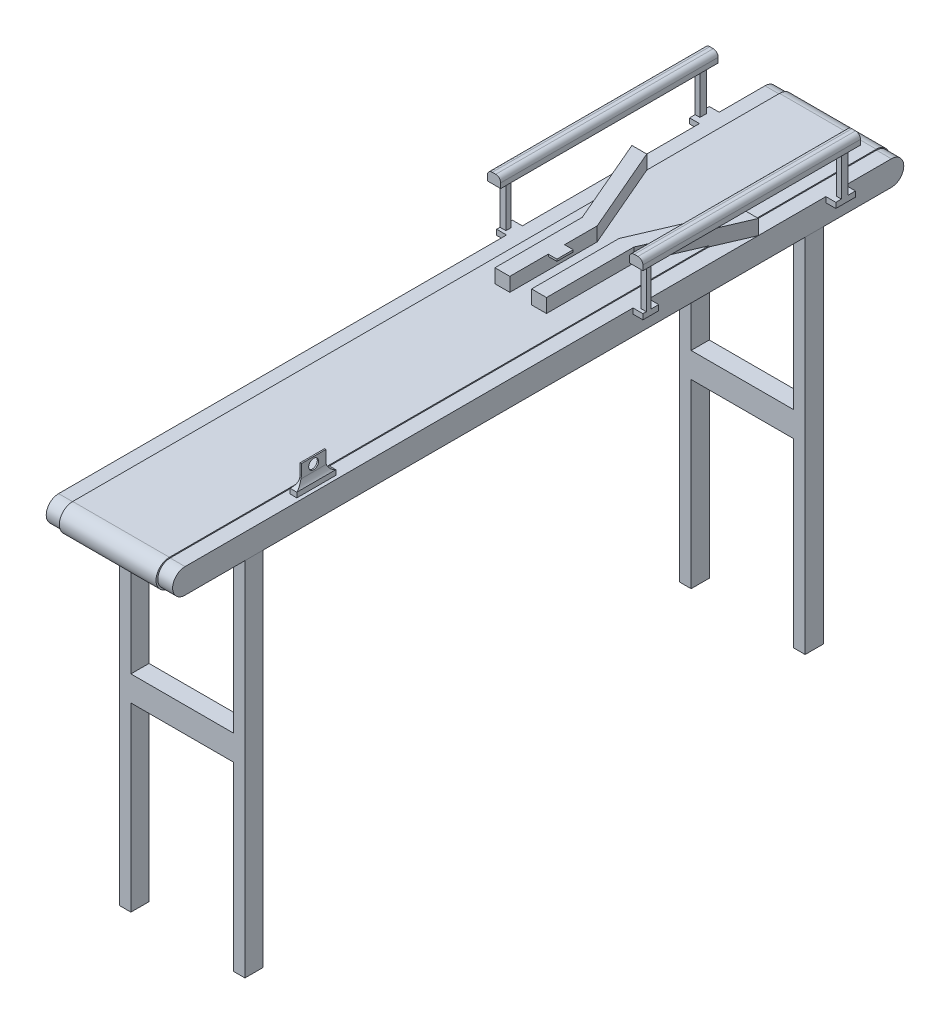
from build123d import *

# Parameters (mm, degrees)
CROQUIS1_W                   = 255
CROQUIS1_H                   = 1475
SALIENTE_EXTRUIR1_DEPTH      = 50
CORTAR_EXTRUIR1_DEPTH        = 1498.714926146
SALIENTE_EXTRUIR2_START      = -30
SALIENTE_EXTRUIR2_DEPTH      = 195
CROQUIS6_W                   = 23.089927544
CROQUIS6_H                   = 36.579574148
SALIENTE_EXTRUIR3_DEPTH      = 731
SALIENTE_EXTRUIR4_REACH      = 1668.675
CROQUIS7_W                   = 36.579574148
CROQUIS7_H                   = 50.716877677
SALIENTE_EXTRUIR5_DEPTH      = 20
SALIENTE_EXTRUIR5_DEPTH_BACK = 275
CROQUIS9_W                   = 39.769947059
CROQUIS9_H                   = 10.786278749
CROQUIS9_W_2                 = 31.799661674
CROQUIS10_W                  = 9.640500607
CROQUIS10_H                  = 13.128056889
CROQUIS10_W_2                = 10.31069774
CROQUIS10_W_3                = 11.904259836
CROQUIS10_H_2                = 10.427339656
CROQUIS10_H_3                = 9.058106281
SALIENTE_EXTRUIR6_DEPTH      = 85
CROQUIS11_W                  = 27.062582302
CROQUIS11_H                  = 438.810649055
CROQUIS11_W_2                = 27.39424904
SALIENTE_EXTRUIR7_DEPTH      = 20
REDONDEO1_R                  = 10
SALIENTE_EXTRUIR8_DEPTH      = 30
CROQUIS13_W                  = 30
CROQUIS13_H                  = 176.208611665
SALIENTE_EXTRUIR9_DEPTH      = 30
CROQUIS14_W                  = 17.440501772
CROQUIS14_H                  = 32.827990866
SALIENTE_EXTRUIR10_DEPTH     = 4
CROQUIS15_W                  = 88.168794784
CROQUIS15_H                  = 128.918218337
SALIENTE_EXTRUIR11_DEPTH     = 10
CROQUIS16_R                  = 2.5
CROQUIS16_W                  = 10.651190854
CROQUIS16_H                  = 24.522509177
SALIENTE_EXTRUIR12_DEPTH     = 5
CROQUIS17_W                  = 58.168794784
CROQUIS17_H                  = 13.953634649
SALIENTE_EXTRUIR13_DEPTH     = 2
CROQUIS18_W                  = 58.168794784
CROQUIS18_H                  = 2
SALIENTE_EXTRUIR14_DEPTH     = 40
CROQUIS19_W                  = 13.463338371
CROQUIS19_H                  = 78.536140501
SALIENTE_EXTRUIR15_DEPTH     = 10
CROQUIS20_W                  = 2.68
CROQUIS20_H                  = 49.502102937
SALIENTE_EXTRUIR16_DEPTH     = 40
REDONDEO2_R                  = 20
CROQUIS21_R                  = 10
CORTAR_EXTRUIR2_DEPTH        = 40


with BuildPart() as part:
    # Croquis1 → Saliente-Extruir1 (new body)
    with BuildSketch(Plane(origin=(0, 0, 0), x_dir=(1, 0, 0), z_dir=(0, 1, 0))):
        with Locations((-127.5, 737.5)):
            Rectangle(CROQUIS1_W, CROQUIS1_H)
    extrude(amount=SALIENTE_EXTRUIR1_DEPTH)

    # Croquis2 → Cortar-Extruir1 (cut, through all)
    with BuildSketch(Plane.ZY.offset(255)):
        with BuildLine():
            Line((6.458362323, -12.380571648), (-25, 0))
            ThreePointArc((-25, 0), (0, 25), (-25, 50))
            Line((-25, 50), (5.438958409, 62.035914062))
            Line((5.438958409, 62.035914062), (6.458362323, -12.380571648))
        make_face()
        with BuildLine():
            Line((-1481.23440759, 62.380571648), (-1449.776045267, 50))
            ThreePointArc((-1449.776045267, 50), (-1474.776045267, 25), (-1449.776045267, 0))
            Line((-1449.776045267, 0), (-1480.215003676, -12.035914062))
            Line((-1480.215003676, -12.035914062), (-1481.23440759, 62.380571648))
        make_face()
    extrude(amount=-CORTAR_EXTRUIR1_DEPTH, mode=Mode.SUBTRACT)

    # Croquis5 → Saliente-Extruir2 (add)
    with BuildSketch(Plane.ZY.offset(255).offset(SALIENTE_EXTRUIR2_START)):
        with BuildLine():
            Line((-1449.276045267, 52), (-23.5, 52))
            ThreePointArc((-23.5, 52), (3.5, 25), (-23.5, -2))
            Line((-23.5, -2), (-1449.276045267, -2))
            ThreePointArc((-1449.276045267, -2), (-1476.276045267, 25), (-1449.276045267, 52))
        make_face()
    extrude(amount=-SALIENTE_EXTRUIR2_DEPTH)

    # Croquis6 → Saliente-Extruir3 (add)
    with BuildSketch(Plane.XZ):
        with Locations((-243.455036228, -166.019692376)):
            Rectangle(CROQUIS6_W, CROQUIS6_H)
        with Locations((-13.455036228, -166.019692376)):
            Rectangle(CROQUIS6_W, CROQUIS6_H)
        with Locations((-13.455036228, -1296.019692376)):
            Rectangle(CROQUIS6_W, CROQUIS6_H)
        with Locations((-243.455036228, -1296.019692376)):
            Rectangle(CROQUIS6_W, CROQUIS6_H)
    extrude(amount=SALIENTE_EXTRUIR3_DEPTH)

    # Croquis7 → Saliente-Extruir4 (add, up to next)
    with BuildSketch(Plane(origin=(-1.910072456, 0, 0), x_dir=(0, 0, -1), z_dir=(1, 0, 0)), mode=Mode.PRIVATE) as saliente_extruir4_sk1:
        with Locations((166.019692376, -340.141561162)):
            Rectangle(CROQUIS7_W, CROQUIS7_H)
    saliente_extruir4_tool1 = extrude(saliente_extruir4_sk1.sketch, amount=-SALIENTE_EXTRUIR4_REACH, mode=Mode.PRIVATE) - part.part
    # Croquis7 → Saliente-Extruir4 (add, up to next)
    with BuildSketch(Plane(origin=(-1.910072456, 0, 0), x_dir=(0, 0, -1), z_dir=(1, 0, 0)), mode=Mode.PRIVATE) as saliente_extruir4_sk2:
        with Locations((1296.019692376, -340.141561162)):
            Rectangle(CROQUIS7_W, CROQUIS7_H)
    saliente_extruir4_tool2 = extrude(saliente_extruir4_sk2.sketch, amount=-SALIENTE_EXTRUIR4_REACH, mode=Mode.PRIVATE) - part.part
    add(saliente_extruir4_tool1.solids().sort_by_distance((-1.910072, -340.141561, -166.019692))[0])
    add(saliente_extruir4_tool2.solids().sort_by_distance((-1.910072, -340.141561, -1296.019692))[0])

    # Croquis9 → Saliente-Extruir5 (add, two sides: drawn at the far end of the back side and taken through both)
    with BuildSketch(Plane.ZY.offset(255).offset(-SALIENTE_EXTRUIR5_DEPTH_BACK)):
        with Locations((-1337.547382333, 44.606860626)):
            Rectangle(CROQUIS9_W, CROQUIS9_H)
        with Locations((-944.49167922, 44.606860626)):
            Rectangle(CROQUIS9_W_2, CROQUIS9_H)
    extrude(amount=SALIENTE_EXTRUIR5_DEPTH + SALIENTE_EXTRUIR5_DEPTH_BACK)

    # Croquis10 → Saliente-Extruir6 (add)
    with BuildSketch(Plane(origin=(0, 50, 0), x_dir=(1, 0, 0), z_dir=(0, 1, 0))):
        with Locations((-270.179749697, 1335.537426787)):
            Rectangle(CROQUIS10_W, CROQUIS10_H)
        with Locations((14.84465113, 1335.537426787)):
            Rectangle(CROQUIS10_W_2, CROQUIS10_H)
        with Locations((-269.047870082, 940.647242767)):
            Rectangle(CROQUIS10_W_3, CROQUIS10_H_2)
        with Locations((14.84465113, 939.96262608)):
            Rectangle(CROQUIS10_W_2, CROQUIS10_H_3)
    extrude(amount=SALIENTE_EXTRUIR6_DEPTH)

    # Croquis11 → Saliente-Extruir7 (add)
    with BuildSketch(Plane(origin=(0, 135, 0), x_dir=(1, 0, 0), z_dir=(0, 1, 0))):
        with Locations((-270.45368875, 1138.027031334)):
            Rectangle(CROQUIS11_W, CROQUIS11_H)
        with Locations((16.285457001, 1138.027031334)):
            Rectangle(CROQUIS11_W_2, CROQUIS11_H)
    extrude(amount=SALIENTE_EXTRUIR7_DEPTH)

    # Redondeo1
    redondeo1_edges = [part.edges().sort_by_distance(p)[0] for p in [
        (-283.984979901, 155, -1138.027031335),
        (-256.922397599, 155, -1138.027031335),
        (29.982581521, 155, -1138.027031335),
        (2.588332481, 155, -1138.027031335),
    ]]
    fillet(redondeo1_edges, radius=REDONDEO1_R)

    # Croquis12 → Saliente-Extruir8 (add)
    with BuildSketch(Plane(origin=(0, 50, 0), x_dir=(1, 0, 0), z_dir=(0, 1, 0))):
        Polygon((-225, 1181.407477402), (-149.5, 1005.791328584), (-179.5, 1005.791328584), (-255, 1181.407477402), align=None)
        Polygon((-105.5, 1005.791328584), (-75.5, 1005.791328584), (0, 1181.407477402), (-30, 1181.407477402), align=None)
    extrude(amount=SALIENTE_EXTRUIR8_DEPTH)

    # Croquis13 → Saliente-Extruir9 (add)
    with BuildSketch(Plane(origin=(0, 50, 0), x_dir=(1, 0, 0), z_dir=(0, 1, 0))):
        with Locations((-164.5, 917.687022752)):
            Rectangle(CROQUIS13_W, CROQUIS13_H)
        with Locations((-90.5, 917.687022752)):
            Rectangle(CROQUIS13_W, CROQUIS13_H)
    extrude(amount=SALIENTE_EXTRUIR9_DEPTH)

    # Croquis14 → Saliente-Extruir10 (add)
    with BuildSketch(Plane(origin=(0, 80, 0), x_dir=(1, 0, 0), z_dir=(0, 1, 0))):
        with Locations((-140.779749114, 923.592229043)):
            Rectangle(CROQUIS14_W, CROQUIS14_H)
    extrude(amount=-SALIENTE_EXTRUIR10_DEPTH)

    # Croquis15 → Saliente-Extruir11 (add)
    with BuildSketch(Plane.ZY.offset(255)):
        with Locations((-191.814302694, -50.562306629)):
            Rectangle(CROQUIS15_W, CROQUIS15_H)
    extrude(amount=SALIENTE_EXTRUIR11_DEPTH)

    # Croquis16 → Saliente-Extruir12 (add)
    with BuildSketch(Plane.ZY.offset(265)):
        with Locations((-191.814302694, -27.70098442)):
            Circle(CROQUIS16_R)
        with Locations((-191.814302694, -84.548619331)):
            Rectangle(CROQUIS16_W, CROQUIS16_H)
    extrude(amount=SALIENTE_EXTRUIR12_DEPTH)

    # Croquis17 → Saliente-Extruir13 (add)
    with BuildSketch(Plane.ZY.offset(265)):
        with Locations((-191.814302694, -40.880014785)):
            Rectangle(CROQUIS17_W, CROQUIS17_H)
    extrude(amount=SALIENTE_EXTRUIR13_DEPTH)

    # Croquis18 → Saliente-Extruir14 (add)
    with BuildSketch(Plane.ZY.offset(267)):
        with Locations((-191.814302694, -34.90319746)):
            Rectangle(CROQUIS18_W, CROQUIS18_H)
    extrude(amount=SALIENTE_EXTRUIR14_DEPTH)

    # Croquis19 → Saliente-Extruir15 (add)
    with BuildSketch(Plane(origin=(0, 50, 0), x_dir=(1, 0, 0), z_dir=(0, 1, 0))):
        with Locations((-13.948403815, 297.024489039)):
            Rectangle(CROQUIS19_W, CROQUIS19_H)
    extrude(amount=SALIENTE_EXTRUIR15_DEPTH)

    # Croquis20 → Saliente-Extruir16 (add)
    with BuildSketch(Plane(origin=(0, 60, 0), x_dir=(1, 0, 0), z_dir=(0, 1, 0))):
        with Locations((-13.948403815, 297.024489039)):
            Rectangle(CROQUIS20_W, CROQUIS20_H)
    extrude(amount=SALIENTE_EXTRUIR16_DEPTH)

    # Redondeo2
    # the kernel refuses this fillet: 20 mm, written as the material it adds along each edge
    with BuildSketch(Plane(origin=(-15.288403815, 60, -272.27343757), x_dir=(-1, 0, 0), z_dir=(0, 0, -1)), Plane(origin=(-12.608403815, 60, -321.775540507), x_dir=(1, 0, 0), z_dir=(0, 0, 1))) as redondeo2_piece_1:
        with BuildLine():
            CenterArc((20, 13.660039196), REDONDEO2_R, 180, 43.078674496)
            Line((0, 13.660039196), (-0.4, 13.660039196))
            Line((-0.4, 13.660039196), (-0.4, 0))
            Line((-0.4, 0), (0, -0.4))
            ThreePointArc((0, -0.4), (2.695834593, -0.4), (5.09950257, -0.273200784))
            Line((5.09950257, -0.273200784), (5.391669186, 0))
        make_face()
    extrude(amount=49.502102937)
    with BuildSketch(Plane(origin=(-12.608403815, 60, -272.27343757), x_dir=(0, 0, 1), z_dir=(-1, 0, 0)), Plane(origin=(-15.288403815, 60, -321.775540507), x_dir=(0, 0, -1), z_dir=(1, 0, 0))) as redondeo2_piece_2:
        with BuildLine():
            CenterArc((20, 19.233744226), REDONDEO2_R, 180, 74.088689825)
            Line((0, 19.233744226), (-0.4, 19.233744226))
            Line((-0.4, 19.233744226), (-0.4, 0))
            Line((-0.4, 0), (0, -0.4))
            ThreePointArc((0, -0.4), (7.258509391, -0.4), (14.407359158, -0.384674885))
            Line((14.407359158, -0.384674885), (14.517018782, 0))
        make_face()
    extrude(amount=2.68)
    with BuildSketch(Plane(origin=(-12.608403815, 60, -272.27343757), x_dir=(0, 0, 1), z_dir=(-1, 0, 0))) as redondeo2_piece_3a_section:
        with BuildLine():
            CenterArc((20, 19.233744226), REDONDEO2_R, 180, 74.088689825)
            Line((0, 19.233744226), (-0.4, 19.233744226))
            Line((-0.4, 19.233744226), (-0.4, 0))
            Line((-0.4, 0), (0, -0.4))
            ThreePointArc((0, -0.4), (7.258509391, -0.4), (14.407359158, -0.384674885))
            Line((14.407359158, -0.384674885), (14.517018782, 0))
        make_face()
    redondeo2_piece_3a = extrude(amount=50.764360566, mode=Mode.PRIVATE)
    redondeo2_piece_3a = split(redondeo2_piece_3a, bisect_by=Plane(origin=(-20.680073, 64.554462373, -268.58410709), z_dir=(1, 0, 0)), keep=Keep.TOP, mode=Mode.PRIVATE)
    redondeo2_piece_3a = split(redondeo2_piece_3a, bisect_by=Plane(origin=(-15.288403815, 64.554462373, -268.58410709), z_dir=(-1, 0, 0)), keep=Keep.TOP, mode=Mode.PRIVATE)
    with BuildSketch(Plane(origin=(-15.288403815, 60, -238.123339581), x_dir=(-1, 0, 0), z_dir=(0, 0, -1))) as redondeo2_piece_3b_section:
        with BuildLine():
            CenterArc((20, 13.660039196), REDONDEO2_R, 180, 43.078674496)
            Line((0, 13.660039196), (-0.4, 13.660039196))
            Line((-0.4, 13.660039196), (-0.4, 0))
            Line((-0.4, 0), (0, -0.4))
            ThreePointArc((0, -0.4), (2.695834593, -0.4), (5.09950257, -0.273200784))
            Line((5.09950257, -0.273200784), (5.391669186, 0))
        make_face()
    redondeo2_piece_3b = extrude(amount=83.652200925, mode=Mode.PRIVATE)
    redondeo2_piece_3b = split(redondeo2_piece_3b, bisect_by=Plane(origin=(-16.597108133, 63.707255997, -257.756418788), z_dir=(0, 0, -1)), keep=Keep.TOP, mode=Mode.PRIVATE)
    redondeo2_piece_3b = split(redondeo2_piece_3b, bisect_by=Plane(origin=(-16.597108133, 63.707255997, -272.27343757), z_dir=(0, 0, 1)), keep=Keep.TOP, mode=Mode.PRIVATE)
    redondeo2_piece_3 = redondeo2_piece_3a & redondeo2_piece_3b
    add(redondeo2_piece_3)
    with BuildSketch(Plane(origin=(-63.372764381, 60, -321.775540507), x_dir=(0, 0, -1), z_dir=(1, 0, 0))) as redondeo2_piece_4a_section:
        with BuildLine():
            CenterArc((20, 19.233744226), REDONDEO2_R, 180, 74.088689825)
            Line((0, 19.233744226), (-0.4, 19.233744226))
            Line((-0.4, 19.233744226), (-0.4, 0))
            Line((-0.4, 0), (0, -0.4))
            ThreePointArc((0, -0.4), (7.258509391, -0.4), (14.407359158, -0.384674885))
            Line((14.407359158, -0.384674885), (14.517018782, 0))
        make_face()
    redondeo2_piece_4a = extrude(amount=50.764360566, mode=Mode.PRIVATE)
    redondeo2_piece_4a = split(redondeo2_piece_4a, bisect_by=Plane(origin=(-20.680073, 64.554462373, -325.464870987), z_dir=(1, 0, 0)), keep=Keep.TOP, mode=Mode.PRIVATE)
    redondeo2_piece_4a = split(redondeo2_piece_4a, bisect_by=Plane(origin=(-15.288403815, 64.554462373, -325.464870987), z_dir=(-1, 0, 0)), keep=Keep.TOP, mode=Mode.PRIVATE)
    with BuildSketch(Plane(origin=(-15.288403815, 60, -272.27343757), x_dir=(-1, 0, 0), z_dir=(0, 0, -1))) as redondeo2_piece_4b_section:
        with BuildLine():
            CenterArc((20, 13.660039196), REDONDEO2_R, 180, 43.078674496)
            Line((0, 13.660039196), (-0.4, 13.660039196))
            Line((-0.4, 13.660039196), (-0.4, 0))
            Line((-0.4, 0), (0, -0.4))
            ThreePointArc((0, -0.4), (2.695834593, -0.4), (5.09950257, -0.273200784))
            Line((5.09950257, -0.273200784), (5.391669186, 0))
        make_face()
    redondeo2_piece_4b = extrude(amount=83.652200925, mode=Mode.PRIVATE)
    redondeo2_piece_4b = split(redondeo2_piece_4b, bisect_by=Plane(origin=(-16.597108133, 63.707255997, -336.292559289), z_dir=(0, 0, 1)), keep=Keep.TOP, mode=Mode.PRIVATE)
    redondeo2_piece_4b = split(redondeo2_piece_4b, bisect_by=Plane(origin=(-16.597108133, 63.707255997, -321.775540507), z_dir=(0, 0, -1)), keep=Keep.TOP, mode=Mode.PRIVATE)
    redondeo2_piece_4 = redondeo2_piece_4a & redondeo2_piece_4b
    add(redondeo2_piece_4)
    with BuildSketch(Plane(origin=(-12.608403815, 60, -321.775540507), x_dir=(1, 0, 0), z_dir=(0, 0, 1))) as redondeo2_piece_5a_section:
        with BuildLine():
            CenterArc((20, 13.660039196), REDONDEO2_R, 180, 43.078674496)
            Line((0, 13.660039196), (-0.4, 13.660039196))
            Line((-0.4, 13.660039196), (-0.4, 0))
            Line((-0.4, 0), (0, -0.4))
            ThreePointArc((0, -0.4), (2.695834593, -0.4), (5.09950257, -0.273200784))
            Line((5.09950257, -0.273200784), (5.391669186, 0))
        make_face()
    redondeo2_piece_5a = extrude(amount=83.652200925, mode=Mode.PRIVATE)
    redondeo2_piece_5a = split(redondeo2_piece_5a, bisect_by=Plane(origin=(-11.299699497, 63.707255997, -257.756418788), z_dir=(0, 0, -1)), keep=Keep.TOP, mode=Mode.PRIVATE)
    redondeo2_piece_5a = split(redondeo2_piece_5a, bisect_by=Plane(origin=(-11.299699497, 63.707255997, -272.27343757), z_dir=(0, 0, 1)), keep=Keep.TOP, mode=Mode.PRIVATE)
    with BuildSketch(Plane(origin=(35.475956751, 60, -272.27343757), x_dir=(0, 0, 1), z_dir=(-1, 0, 0))) as redondeo2_piece_5b_section:
        with BuildLine():
            CenterArc((20, 19.233744226), REDONDEO2_R, 180, 74.088689825)
            Line((0, 19.233744226), (-0.4, 19.233744226))
            Line((-0.4, 19.233744226), (-0.4, 0))
            Line((-0.4, 0), (0, -0.4))
            ThreePointArc((0, -0.4), (7.258509391, -0.4), (14.407359158, -0.384674885))
            Line((14.407359158, -0.384674885), (14.517018782, 0))
        make_face()
    redondeo2_piece_5b = extrude(amount=50.764360566, mode=Mode.PRIVATE)
    redondeo2_piece_5b = split(redondeo2_piece_5b, bisect_by=Plane(origin=(-7.216734629, 64.554462373, -268.58410709), z_dir=(-1, 0, 0)), keep=Keep.TOP, mode=Mode.PRIVATE)
    redondeo2_piece_5b = split(redondeo2_piece_5b, bisect_by=Plane(origin=(-12.608403815, 64.554462373, -268.58410709), z_dir=(1, 0, 0)), keep=Keep.TOP, mode=Mode.PRIVATE)
    redondeo2_piece_5 = redondeo2_piece_5a & redondeo2_piece_5b
    add(redondeo2_piece_5)
    with BuildSketch(Plane(origin=(-15.288403815, 60, -321.775540507), x_dir=(0, 0, -1), z_dir=(1, 0, 0))) as redondeo2_piece_6a_section:
        with BuildLine():
            CenterArc((20, 19.233744226), REDONDEO2_R, 180, 74.088689825)
            Line((0, 19.233744226), (-0.4, 19.233744226))
            Line((-0.4, 19.233744226), (-0.4, 0))
            Line((-0.4, 0), (0, -0.4))
            ThreePointArc((0, -0.4), (7.258509391, -0.4), (14.407359158, -0.384674885))
            Line((14.407359158, -0.384674885), (14.517018782, 0))
        make_face()
    redondeo2_piece_6a = extrude(amount=50.764360566, mode=Mode.PRIVATE)
    redondeo2_piece_6a = split(redondeo2_piece_6a, bisect_by=Plane(origin=(-7.216734629, 64.554462373, -325.464870987), z_dir=(-1, 0, 0)), keep=Keep.TOP, mode=Mode.PRIVATE)
    redondeo2_piece_6a = split(redondeo2_piece_6a, bisect_by=Plane(origin=(-12.608403815, 64.554462373, -325.464870987), z_dir=(1, 0, 0)), keep=Keep.TOP, mode=Mode.PRIVATE)
    with BuildSketch(Plane(origin=(-12.608403815, 60, -355.925638495), x_dir=(1, 0, 0), z_dir=(0, 0, 1))) as redondeo2_piece_6b_section:
        with BuildLine():
            CenterArc((20, 13.660039196), REDONDEO2_R, 180, 43.078674496)
            Line((0, 13.660039196), (-0.4, 13.660039196))
            Line((-0.4, 13.660039196), (-0.4, 0))
            Line((-0.4, 0), (0, -0.4))
            ThreePointArc((0, -0.4), (2.695834593, -0.4), (5.09950257, -0.273200784))
            Line((5.09950257, -0.273200784), (5.391669186, 0))
        make_face()
    redondeo2_piece_6b = extrude(amount=83.652200925, mode=Mode.PRIVATE)
    redondeo2_piece_6b = split(redondeo2_piece_6b, bisect_by=Plane(origin=(-11.299699497, 63.707255997, -336.292559289), z_dir=(0, 0, 1)), keep=Keep.TOP, mode=Mode.PRIVATE)
    redondeo2_piece_6b = split(redondeo2_piece_6b, bisect_by=Plane(origin=(-11.299699497, 63.707255997, -321.775540507), z_dir=(0, 0, -1)), keep=Keep.TOP, mode=Mode.PRIVATE)
    redondeo2_piece_6 = redondeo2_piece_6a & redondeo2_piece_6b
    add(redondeo2_piece_6)

    # Croquis21 → Cortar-Extruir2 (cut)
    with BuildSketch(Plane(origin=(-12.608403815, 0, 0), x_dir=(0, 0, -1), z_dir=(1, 0, 0))):
        with Locations((297.024489038, 86.84464624)):
            Circle(CROQUIS21_R)
    extrude(amount=-CORTAR_EXTRUIR2_DEPTH, mode=Mode.SUBTRACT)


solid = part.part
